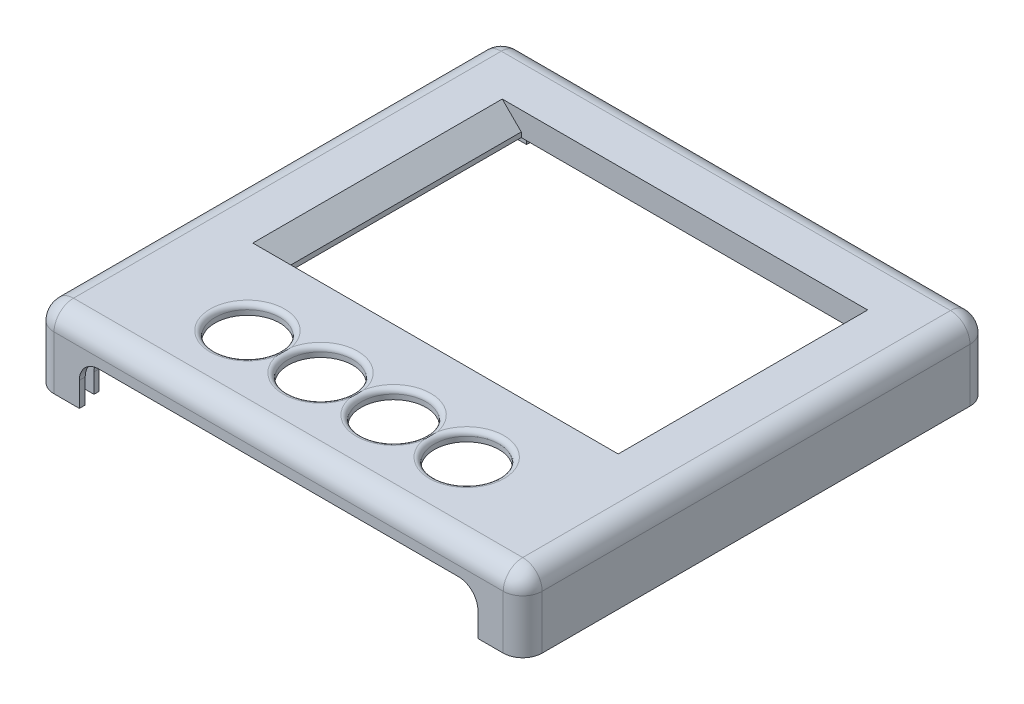
from build123d import *

# Parameters (mm, degrees)
SKETCH_2_W               = 100.2
SKETCH_2_H               = 95.8
SKETCH_2_R               = 6.65
SKETCH_2_W_2             = 67.2
SKETCH_2_H_2             = 51.2
EXTRUDE_1_DEPTH          = 2
SKETCH_21_W              = 100.2
SKETCH_21_H              = 95.8
SKETCH_21_W_2            = 96.2
SKETCH_21_H_2            = 87.8
EXTRUDE_3_DEPTH          = 12
SKETCH_24_W              = 100.2
SKETCH_24_H              = 95.8
SKETCH_24_W_2            = 97.8
SKETCH_24_H_2            = 93.4
EXTRUDE_4_DEPTH          = 1
SKETCH_25_W              = 85.8
SKETCH_25_H              = 1.8
CUT_EXTRUDE_5_DEPTH      = 10
SKETCH_29_W              = 81.8
SKETCH_29_H              = 4
CUT_EXTRUDE_7_DEPTH      = 9
SKETCH_32_R              = 3
EXTRUDE_7_DEPTH          = 7
MIRROR_7_COPY_1_SKETCH_R = 3
MIRROR_7_COPY_1_DEPTH    = 7
FILLET_3_R               = 4
FILLET_4_R               = 1
HOLE_WIZARD_M34_D        = 3.15
HOLE_WIZARD_M34_DEPTH    = 5
HOLE_WIZARD_M34_TIP      = 0.946355475
FILLET_7_R               = 3
FILLET_6_R               = 4
FILLET_8_R               = 4
SKETCH_49_W              = 71.2
SKETCH_49_H              = 55.2
SKETCH_49_W_2            = 67.2
SKETCH_49_H_2            = 51.2
EXTRUDE_12_DEPTH         = 2.9
SKETCH_52_R              = 2.5
EXTRUDE_13_DEPTH         = 5.8
HOLE_WIZARD_M35_D        = 3.15
HOLE_WIZARD_M35_DEPTH    = 5
HOLE_WIZARD_M35_TIP      = 0.946355475
SKETCH_55_W              = 51.2
SKETCH_55_H              = 6
CUT_EXTRUDE_8_DEPTH      = 3
SKETCH_56_R              = 2.5
EXTRUDE_14_DEPTH         = 7.5
HOLE_WIZARD_M2_22_D      = 2.3
HOLE_WIZARD_M2_22_DEPTH  = 5
HOLE_WIZARD_M2_22_TIP    = 0.690989712


with BuildPart() as part:
    # Эскиз2 → Бобышка-Вытянуть1 (new body)
    with BuildSketch(Plane(origin=(0, 0, 0), x_dir=(1, 0, 0), z_dir=(0, 1, 0))):
        with Locations((0, -9.9)):
            Rectangle(SKETCH_2_W, SKETCH_2_H)
        with Locations(Location((-22.5, -41.7, 0), (0, 0, 270))):
            Circle(SKETCH_2_R, mode=Mode.SUBTRACT)
        with Locations(Location((-7.5, -41.7, 0), (0, 0, 270))):
            Circle(SKETCH_2_R, mode=Mode.SUBTRACT)
        with Locations(Location((7.5, -41.7, 0), (0, 0, 270))):
            Circle(SKETCH_2_R, mode=Mode.SUBTRACT)
        with Locations(Location((22.5, -41.7, 0), (0, 0, 270))):
            Circle(SKETCH_2_R, mode=Mode.SUBTRACT)
        Rectangle(SKETCH_2_W_2, SKETCH_2_H_2, mode=Mode.SUBTRACT)
    extrude(amount=EXTRUDE_1_DEPTH)

    # Эскиз21 → Бобышка-Вытянуть3 (add)
    with BuildSketch(Plane.XZ):
        with Locations((0, 9.9)):
            Rectangle(SKETCH_21_W, SKETCH_21_H)
        with Locations((0, 9.9)):
            Rectangle(SKETCH_21_W_2, SKETCH_21_H_2, mode=Mode.SUBTRACT)
    extrude(amount=EXTRUDE_3_DEPTH)

    # Эскиз24 → Бобышка-Вытянуть4 (add)
    with BuildSketch(Plane.XZ.offset(12)):
        with Locations((0, 9.9)):
            Rectangle(SKETCH_24_W, SKETCH_24_H)
        with Locations((0, 9.9)):
            Rectangle(SKETCH_24_W_2, SKETCH_24_H_2, mode=Mode.SUBTRACT)
    extrude(amount=EXTRUDE_4_DEPTH)

    # Эскиз25 → Вырез-Вытянуть5 (cut)
    with BuildSketch(Plane.XZ.offset(12)):
        with Locations((0, 55.7)):
            Rectangle(SKETCH_25_W, SKETCH_25_H)
    cut_extrude_5 = extrude(amount=-CUT_EXTRUDE_5_DEPTH, mode=Mode.SUBTRACT)

    # Зеркальное отражение2: Вырез-Вытянуть5 across plane
    add(cut_extrude_5.mirror(Plane.XY.offset(9.9)), mode=Mode.SUBTRACT)

    # Эскиз29 → Вырез-Вытянуть7 (cut)
    with BuildSketch(Plane.XZ.offset(13)):
        with Locations((0, 55.8)):
            Rectangle(SKETCH_29_W, SKETCH_29_H)
    cut_extrude_7 = extrude(amount=-CUT_EXTRUDE_7_DEPTH, mode=Mode.SUBTRACT)

    # Зеркальное отражение3: Вырез-Вытянуть7 across plane
    add(cut_extrude_7.mirror(Plane.XY.offset(9.9)), mode=Mode.SUBTRACT)

    # Эскиз32 → Бобышка-Вытянуть7 (add)
    with BuildSketch(Plane.XZ):
        with Locations(Location((-44.1, -30, 0), (0, 0, 90))):
            Circle(SKETCH_32_R)
    extrude_7 = extrude(amount=EXTRUDE_7_DEPTH)

    # Зеркальное отражение6: Бобышка-Вытянуть7 across plane
    add(extrude_7.mirror(Plane(origin=(0, 0, 0), x_dir=(0, 0, 1), z_dir=(1, 0, 0))))

    # Зеркальное отражение7: Бобышка-Вытянуть7 across plane
    add(extrude_7.mirror(Plane.XY.offset(9.9)))

    # Зеркальное отражение7 copy 1 sketch → Зеркальное отражение7 copy 1 (add)
    with BuildSketch(Plane(origin=(0, 0, 19.8), x_dir=(-1, 0, 0), z_dir=(0, -1, 0))):
        with Locations(Location((-44.1, -30, 0), (0, 0, 90))):
            Circle(MIRROR_7_COPY_1_SKETCH_R)
    extrude(amount=MIRROR_7_COPY_1_DEPTH)

    # Скругление3
    fillet_3_edges = [part.edges().sort_by_distance(p)[0] for p in [
        (50.1, -5.5, 57.8),
        (-50.1, -5.5, 57.8),
        (-50.1, -5.5, -38),
        (50.1, -5.5, -38),
        (50.1, 2, 9.9),
        (0, 2, -38),
        (-50.1, 2, 9.9),
        (0, 2, 57.8),
    ]]
    fillet(fillet_3_edges, radius=FILLET_3_R)

    # Скругление4
    # the kernel refuses this fillet: 1 mm, written as the material it takes off along each edge
    with BuildSketch(Plane(origin=(-22.5, 2, 41.7), x_dir=(0, 0, 1), z_dir=(-1, 0, 0))) as fillet_4_piece_1:
        with BuildLine():
            CenterArc((6.65 + FILLET_4_R, -FILLET_4_R), FILLET_4_R, 90, 90)
            Line((6.65, -FILLET_4_R), (6.65, 0))
            Line((6.65, 0), (6.65 + FILLET_4_R, 0))
        make_face()
    revolve(axis=Axis((-22.5, 2, 41.7), (0, 1, 0)), mode=Mode.SUBTRACT)
    with BuildSketch(Plane(origin=(-7.5, 2, 41.7), x_dir=(0, 0, 1), z_dir=(-1, 0, 0))) as fillet_4_piece_2:
        with BuildLine():
            CenterArc((6.65 + FILLET_4_R, -FILLET_4_R), FILLET_4_R, 90, 90)
            Line((6.65, -FILLET_4_R), (6.65, 0))
            Line((6.65, 0), (6.65 + FILLET_4_R, 0))
        make_face()
    revolve(axis=Axis((-7.5, 2, 41.7), (0, 1, 0)), mode=Mode.SUBTRACT)
    with BuildSketch(Plane(origin=(7.5, 2, 41.7), x_dir=(0, 0, 1), z_dir=(-1, 0, 0))) as fillet_4_piece_3:
        with BuildLine():
            CenterArc((6.65 + FILLET_4_R, -FILLET_4_R), FILLET_4_R, 90, 90)
            Line((6.65, -FILLET_4_R), (6.65, 0))
            Line((6.65, 0), (6.65 + FILLET_4_R, 0))
        make_face()
    revolve(axis=Axis((7.5, 2, 41.7), (0, 1, 0)), mode=Mode.SUBTRACT)
    with BuildSketch(Plane(origin=(22.5, 2, 41.7), x_dir=(0, 0, 1), z_dir=(-1, 0, 0))) as fillet_4_piece_4:
        with BuildLine():
            CenterArc((6.65 + FILLET_4_R, -FILLET_4_R), FILLET_4_R, 90, 90)
            Line((6.65, -FILLET_4_R), (6.65, 0))
            Line((6.65, 0), (6.65 + FILLET_4_R, 0))
        make_face()
    revolve(axis=Axis((22.5, 2, 41.7), (0, 1, 0)), mode=Mode.SUBTRACT)

    # Сверло под метчик  спиральное M34
    with Locations(Plane(origin=(0, -7, 0), x_dir=(-1, 0, 0), z_dir=(0, -1, 0))):
        with Locations((-44.1, -49.8), (44.1, -49.8), (-44.1, 30), (44.1, 30)):
            Hole(HOLE_WIZARD_M34_D / 2, depth=HOLE_WIZARD_M34_DEPTH)
            with Locations((0, 0, -(HOLE_WIZARD_M34_DEPTH + HOLE_WIZARD_M34_TIP / 2))):  # 118° drill point
                Cone(0, HOLE_WIZARD_M34_D / 2, HOLE_WIZARD_M34_TIP, mode=Mode.SUBTRACT)

    # Скругление7
    fillet_7_edges = [part.edges().sort_by_distance(p)[0] for p in [
        (-48.9, -12.5, -36.8),
        (48.9, -12.5, -36.8),
        (48.9, -12.5, 56.6),
        (-48.9, -12.5, 56.6),
    ]]
    fillet(fillet_7_edges, radius=FILLET_7_R)

    # Скругление6
    fillet_6_edges = [part.edges().sort_by_distance(p)[0] for p in [
        (-40.9, -4, 57.2),
        (40.9, -4, 57.2),
        (-40.9, -4, 54.3),
        (40.9, -4, 54.3),
        (-40.9, -4, -37.4),
        (40.9, -4, -37.4),
        (40.9, -4, -34.5),
        (-40.9, -4, -34.5),
    ]]
    fillet(fillet_6_edges, radius=FILLET_6_R)

    # Скругление8
    # the kernel refuses this fillet: 4 mm, written as the material it adds along each edge
    with BuildSketch(Plane(origin=(48.1, 0, 53.8), x_dir=(0, -1, 0), z_dir=(0, 0, -1)), Plane(origin=(-48.1, 0, -34), x_dir=(0, -1, 0), z_dir=(0, 0, 1))) as fillet_8_piece_1:
        with BuildLine():
            CenterArc((FILLET_8_R, FILLET_8_R), FILLET_8_R, 180, 90)
            Line((0, FILLET_8_R), (0, 0))
            Line((0, 0), (FILLET_8_R, 0))
        make_face()
    extrude(amount=87.8)
    with BuildSketch(Plane(origin=(-48.1, 0, 53.8), x_dir=(0, -1, 0), z_dir=(1, 0, 0)), Plane(origin=(48.1, 0, -34), x_dir=(0, -1, 0), z_dir=(-1, 0, 0))) as fillet_8_piece_2:
        with BuildLine():
            CenterArc((FILLET_8_R, FILLET_8_R), FILLET_8_R, 180, 90)
            Line((0, FILLET_8_R), (0, 0))
            Line((0, 0), (FILLET_8_R, 0))
        make_face()
    extrude(amount=96.2)

    # Эскиз49 → Бобышка-Вытянуть12 (add)
    with BuildSketch(Plane.XZ):
        Rectangle(SKETCH_49_W, SKETCH_49_H)
        Rectangle(SKETCH_49_W_2, SKETCH_49_H_2, mode=Mode.SUBTRACT)
    extrude(amount=EXTRUDE_12_DEPTH)

    # Эскиз52 → Бобышка-Вытянуть13 (add)
    with BuildSketch(Plane.XZ):
        with Locations(Location((-44.4, -24.5, 0), (0, 0, 83.107897421))):
            Circle(SKETCH_52_R)
        with Locations(Location((38.6, 24.5, 0), (0, 0, 90))):
            Circle(SKETCH_52_R)
    extrude(amount=EXTRUDE_13_DEPTH)

    # Сверло под метчик  спиральное M35
    with Locations(Plane(origin=(0, -5.8, 0), x_dir=(-1, 0, 0), z_dir=(0, -1, 0))):
        with Locations((44.4, 24.5), (-38.6, -24.5)):
            Hole(HOLE_WIZARD_M35_D / 2, depth=HOLE_WIZARD_M35_DEPTH)
            with Locations((0, 0, -(HOLE_WIZARD_M35_DEPTH + HOLE_WIZARD_M35_TIP / 2))):  # 118° drill point
                Cone(0, HOLE_WIZARD_M35_D / 2, HOLE_WIZARD_M35_TIP, mode=Mode.SUBTRACT)

    # Эскиз55 → Вырез-Вытянуть8 (cut)
    with BuildSketch(Plane(origin=(17.75, -17.75, 0), x_dir=(0, 0, 1), z_dir=(-0.7071067811865488, 0.7071067811865464, 0))):
        with Locations((0, 25.415284964)):
            Rectangle(SKETCH_55_W, SKETCH_55_H)
    cut_extrude_8 = extrude(amount=CUT_EXTRUDE_8_DEPTH, mode=Mode.SUBTRACT)

    # Зеркальное отражение9: Вырез-Вытянуть8 across plane
    add(cut_extrude_8.mirror(Plane(origin=(0, 0, 0), x_dir=(0, 0, 1), z_dir=(1, 0, 0))), mode=Mode.SUBTRACT)

    # Эскиз56 → Бобышка-Вытянуть14 (add)
    with BuildSketch(Plane.XZ):
        with Locations(Location((37.5, 29.7, 0), (0, 0, 90))):
            Circle(SKETCH_56_R)
        with Locations(Location((-38.5, 29.7, 0), (0, 0, 90))):
            Circle(SKETCH_56_R)
        with Locations(Location((37.5, 45.7, 0), (0, 0, 90))):
            Circle(SKETCH_56_R)
        with Locations(Location((-38.5, 45.7, 0), (0, 0, 90))):
            Circle(SKETCH_56_R)
    extrude(amount=EXTRUDE_14_DEPTH)

    # Сверло под метчик  спиральное M2.22
    with Locations(Plane(origin=(0, -7.5, 0), x_dir=(-1, 0, 0), z_dir=(0, -1, 0))):
        with Locations((-37.5, -29.7), (-37.5, -45.7), (38.5, -45.7), (38.5, -29.7)):
            Hole(HOLE_WIZARD_M2_22_D / 2, depth=HOLE_WIZARD_M2_22_DEPTH)
            with Locations((0, 0, -(HOLE_WIZARD_M2_22_DEPTH + HOLE_WIZARD_M2_22_TIP / 2))):  # 118° drill point
                Cone(0, HOLE_WIZARD_M2_22_D / 2, HOLE_WIZARD_M2_22_TIP, mode=Mode.SUBTRACT)


solid = part.part
